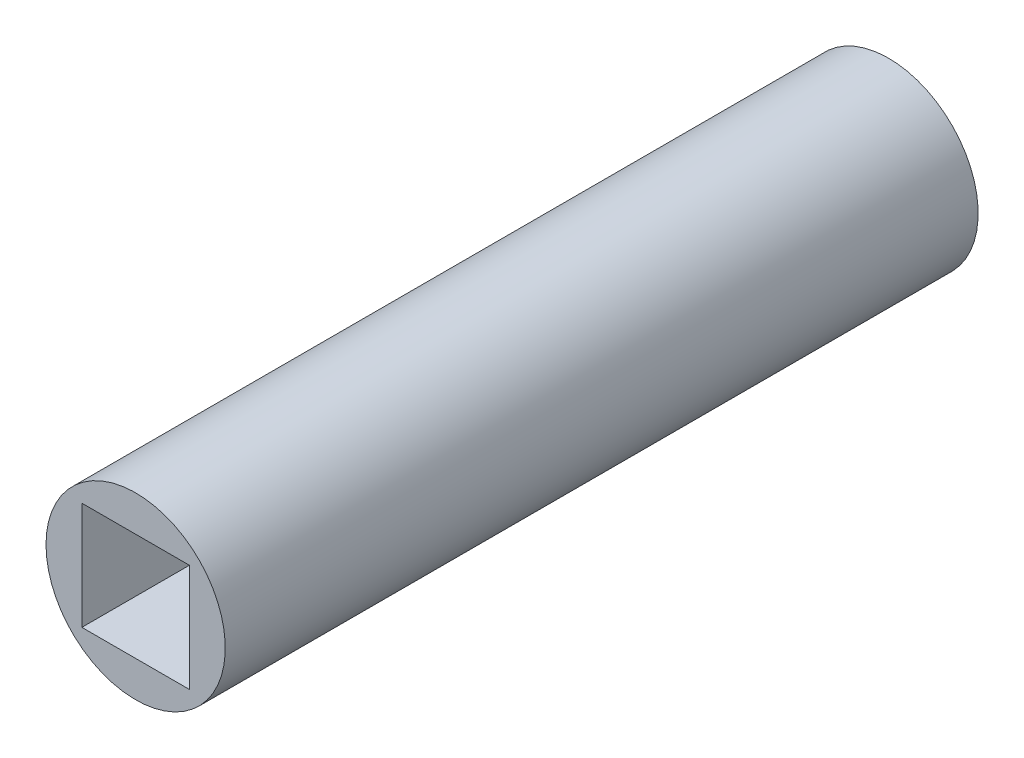
from build123d import *

# Parameters (mm, degrees)
SKETCH1_W          = 15.875
SKETCH1_H          = 133.35
SKETCH2_W          = 19.05
SKETCH2_H          = 19.05
CUT_EXTRUDE1_DEPTH = 136.226675438


with BuildPart() as part:
    # Sketch1 → Revolve1 (revolve)
    with BuildSketch(Plane(origin=(0, 0, 0), x_dir=(1, 0, 0), z_dir=(0, 1, 0))):
        with Locations((-7.9375, -66.675)):
            Rectangle(SKETCH1_W, SKETCH1_H)
    revolve(axis=Axis((0, 0, 0), (0, 0, 1)))

    # Sketch2 → Cut-Extrude1 (cut, through all)
    with BuildSketch(Plane.XY.offset(133.35)):
        Rectangle(SKETCH2_W, SKETCH2_H)
    extrude(amount=-CUT_EXTRUDE1_DEPTH, mode=Mode.SUBTRACT)


solid = part.part
